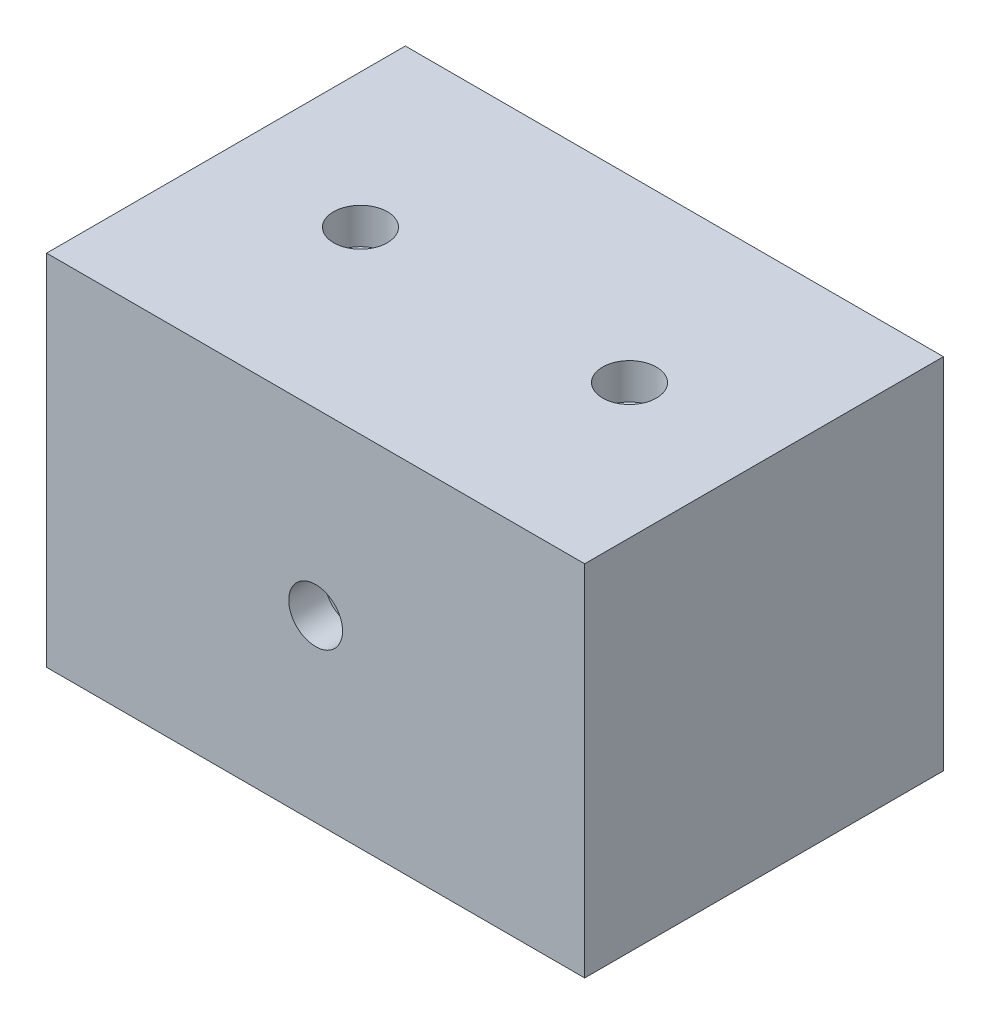
from build123d import *

# Parameters (mm, degrees)
SKETCH1_W           = 30
SKETCH1_H           = 20
BOSS_EXTRUDE1_DEPTH = 20
SKETCH2_R           = 1.5
CUT_EXTRUDE1_DEPTH  = 2
SKETCH3_R           = 1.5
CUT_EXTRUDE2_DEPTH  = 2


with BuildPart() as part:
    # Sketch1 → Boss-Extrude1 (new body)
    with BuildSketch(Plane.XY):
        with Locations((15, 10)):
            Rectangle(SKETCH1_W, SKETCH1_H)
    extrude(amount=BOSS_EXTRUDE1_DEPTH)

    # Sketch2 → Cut-Extrude1 (cut)
    with BuildSketch(Plane.XY.offset(20)):
        with Locations((15, 10)):
            Circle(SKETCH2_R)
    extrude(amount=-CUT_EXTRUDE1_DEPTH, mode=Mode.SUBTRACT)

    # Sketch3 → Cut-Extrude2 (cut)
    with BuildSketch(Plane(origin=(0, 20, 0), x_dir=(1, 0, 0), z_dir=(0, 1, 0))):
        with Locations((7.5, -10)):
            Circle(SKETCH3_R)
        with Locations((22.5, -10)):
            Circle(SKETCH3_R)
    extrude(amount=-CUT_EXTRUDE2_DEPTH, mode=Mode.SUBTRACT)


solid = part.part
